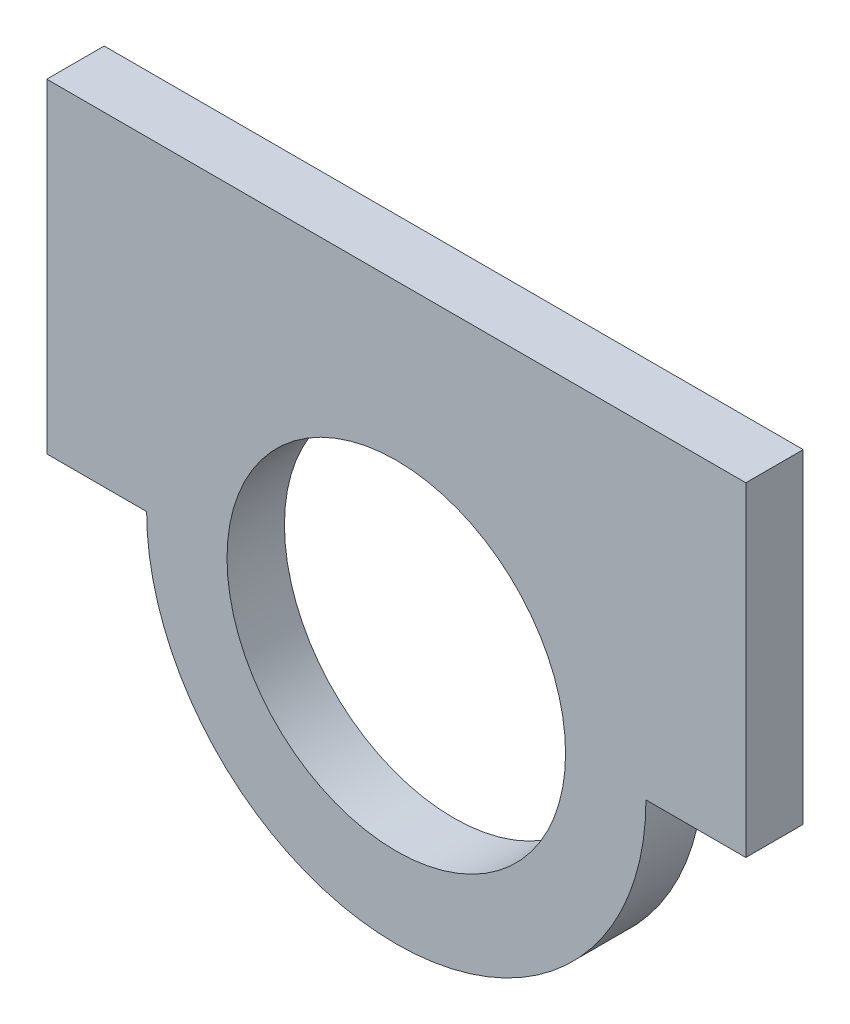
from build123d import *

# Parameters (mm, degrees)
SKETCH_1_R      = 33.9
EXTRUDE_1_DEPTH = 11.5


with BuildPart() as part:
    # Эскиз1 → Бобышка-Вытянуть1 (new body)
    with BuildSketch(Plane.XY):
        with BuildLine():
            Line((70, 65), (-70, 65))
            Line((-70, 65), (-70, 0))
            Line((-70, 0), (-50, 0))
            ThreePointArc((-50, 0), (0, -50), (50, 0))
            Line((50, 0), (70, 0))
            Line((70, 0), (70, 65))
        make_face()
        Circle(SKETCH_1_R, mode=Mode.SUBTRACT)
    extrude(amount=EXTRUDE_1_DEPTH)


solid = part.part
